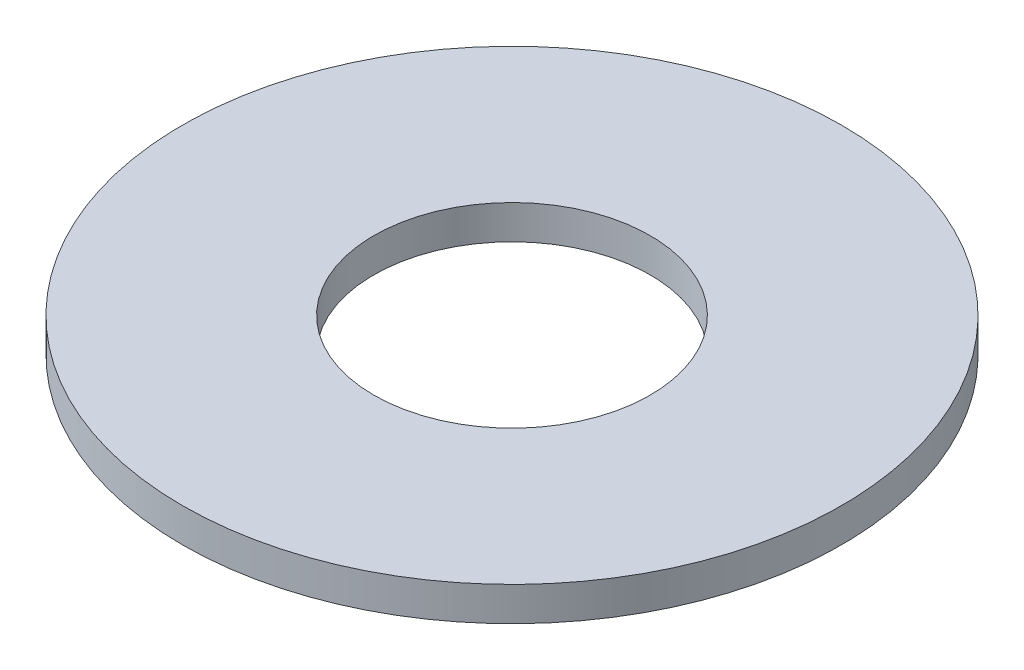
from build123d import *

# Parameters (mm, degrees)
SKETCH1_R           = 77.5
BOSS_EXTRUDE1_DEPTH = 8
SKETCH2_R           = 32.5
CUT_EXTRUDE1_DEPTH  = 110.893129904


with BuildPart() as part:
    # Sketch1 → Boss-Extrude1 (new body)
    with BuildSketch(Plane(origin=(0, 0, 0), x_dir=(1, 0, 0), z_dir=(0, 1, 0))):
        Circle(SKETCH1_R)
    extrude(amount=BOSS_EXTRUDE1_DEPTH)

    # Sketch2 → Cut-Extrude1 (cut, through all)
    with BuildSketch(Plane(origin=(0, 0, 0), x_dir=(1, 0, 0), z_dir=(0, 1, 0))):
        Circle(SKETCH2_R)
    extrude(amount=CUT_EXTRUDE1_DEPTH, mode=Mode.SUBTRACT)


solid = part.part
